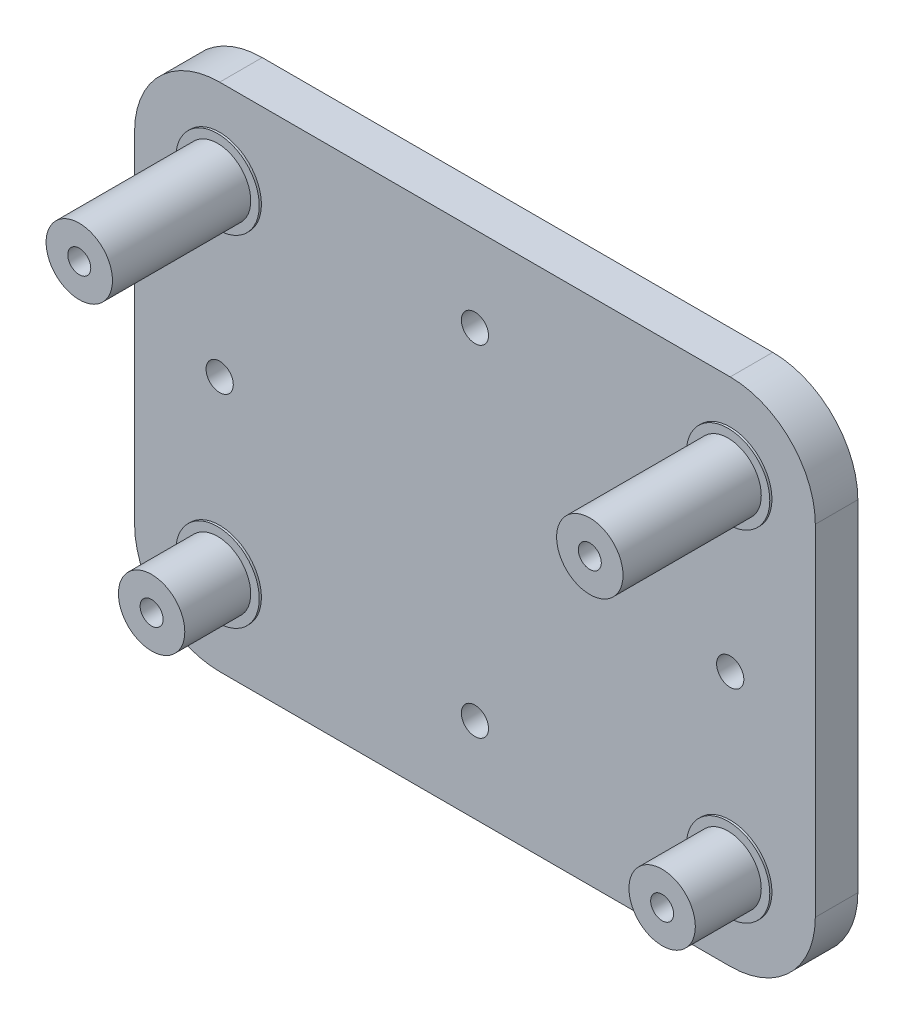
from build123d import *

# Parameters (mm, degrees)
SKETCH1_W               = 80
SKETCH1_H               = 60
BOSS_EXTRUDE1_DEPTH     = 5
SKETCH1_3_R             = 3.9
SKETCH1_3_R_2           = 1.35
BOSS_EXTRUDE2_DEPTH     = 8
SKETCH1_5_R             = 3.9
SKETCH1_5_R_2           = 1.35
BOSS_EXTRUDE4_DEPTH     = 16.5
SKETCH1_4_R             = 4.9
SKETCH1_4_R_2           = 3.9
BOSS_EXTRUDE3_DEPTH     = 0.25
CUT_EXTRUDE1_DEPTH      = 53.65216045
CUT_EXTRUDE1_DEPTH_BACK = 53.65216045
SKETCH1_6_R             = 1.6
FILLET1_R               = 10


with BuildPart() as part:
    # Sketch1 → Boss-Extrude1 (new body)
    with BuildSketch(Plane.XY):
        Rectangle(SKETCH1_W, SKETCH1_H)
    extrude(amount=-BOSS_EXTRUDE1_DEPTH)

    # Sketch1<3> → Boss-Extrude2 (add)
    # profile 1 of 2: a face of its own
    with BuildSketch(Plane.XY):
        with Locations((-30, -20)):
            Circle(SKETCH1_3_R)
        with Locations((-30, -20)):
            Circle(SKETCH1_3_R_2, mode=Mode.SUBTRACT)
    # profile 2 of 2: a face of its own
    with BuildSketch(Plane.XY):
        with Locations((30, -20)):
            Circle(SKETCH1_3_R)
        with Locations((30, -20)):
            Circle(SKETCH1_3_R_2, mode=Mode.SUBTRACT)
    extrude(amount=BOSS_EXTRUDE2_DEPTH)

    # Sketch1<5> → Boss-Extrude4 (add)
    # profile 1 of 2: a face of its own
    with BuildSketch(Plane.XY):
        with Locations((-30, 20)):
            Circle(SKETCH1_5_R)
        with Locations((-30, 20)):
            Circle(SKETCH1_5_R_2, mode=Mode.SUBTRACT)
    # profile 2 of 2: a face of its own
    with BuildSketch(Plane.XY):
        with Locations((30, 20)):
            Circle(SKETCH1_5_R)
        with Locations((30, 20)):
            Circle(SKETCH1_5_R_2, mode=Mode.SUBTRACT)
    extrude(amount=BOSS_EXTRUDE4_DEPTH)

    # Sketch1<4> → Boss-Extrude3 (add)
    # profile 1 of 4: a face of its own
    with BuildSketch(Plane.XY):
        with Locations((-30, 20)):
            Circle(SKETCH1_4_R)
        with Locations((-30, 20)):
            Circle(SKETCH1_4_R_2, mode=Mode.SUBTRACT)
    # profile 2 of 4: a face of its own
    with BuildSketch(Plane.XY):
        with Locations((30, 20)):
            Circle(SKETCH1_4_R)
        with Locations((30, 20)):
            Circle(SKETCH1_4_R_2, mode=Mode.SUBTRACT)
    # profile 3 of 4: a face of its own
    with BuildSketch(Plane.XY):
        with Locations((30, -20)):
            Circle(SKETCH1_4_R)
        with Locations((30, -20)):
            Circle(SKETCH1_4_R_2, mode=Mode.SUBTRACT)
    # profile 4 of 4: a face of its own
    with BuildSketch(Plane.XY):
        with Locations((-30, -20)):
            Circle(SKETCH1_4_R)
        with Locations((-30, -20)):
            Circle(SKETCH1_4_R_2, mode=Mode.SUBTRACT)
    extrude(amount=BOSS_EXTRUDE3_DEPTH)

    # Sketch1<6> → Cut-Extrude1 (cut, two sides: drawn at the far end of the back side and taken through both)
    with BuildSketch(Plane.XY.offset(-CUT_EXTRUDE1_DEPTH_BACK)):
        with Locations((-30, 0)):
            Circle(SKETCH1_6_R)
        with Locations((0, 20)):
            Circle(SKETCH1_6_R)
        with Locations((30, 0)):
            Circle(SKETCH1_6_R)
        with Locations((0, -20)):
            Circle(SKETCH1_6_R)
    extrude(amount=CUT_EXTRUDE1_DEPTH + CUT_EXTRUDE1_DEPTH_BACK, mode=Mode.SUBTRACT)

    # Fillet1
    fillet1_edges = [part.edges().sort_by_distance(p)[0] for p in [
        (40, 30, -2.5),
        (40, -30, -2.5),
        (-40, -30, -2.5),
        (-40, 30, -2.5),
    ]]
    fillet(fillet1_edges, radius=FILLET1_R)


solid = part.part
